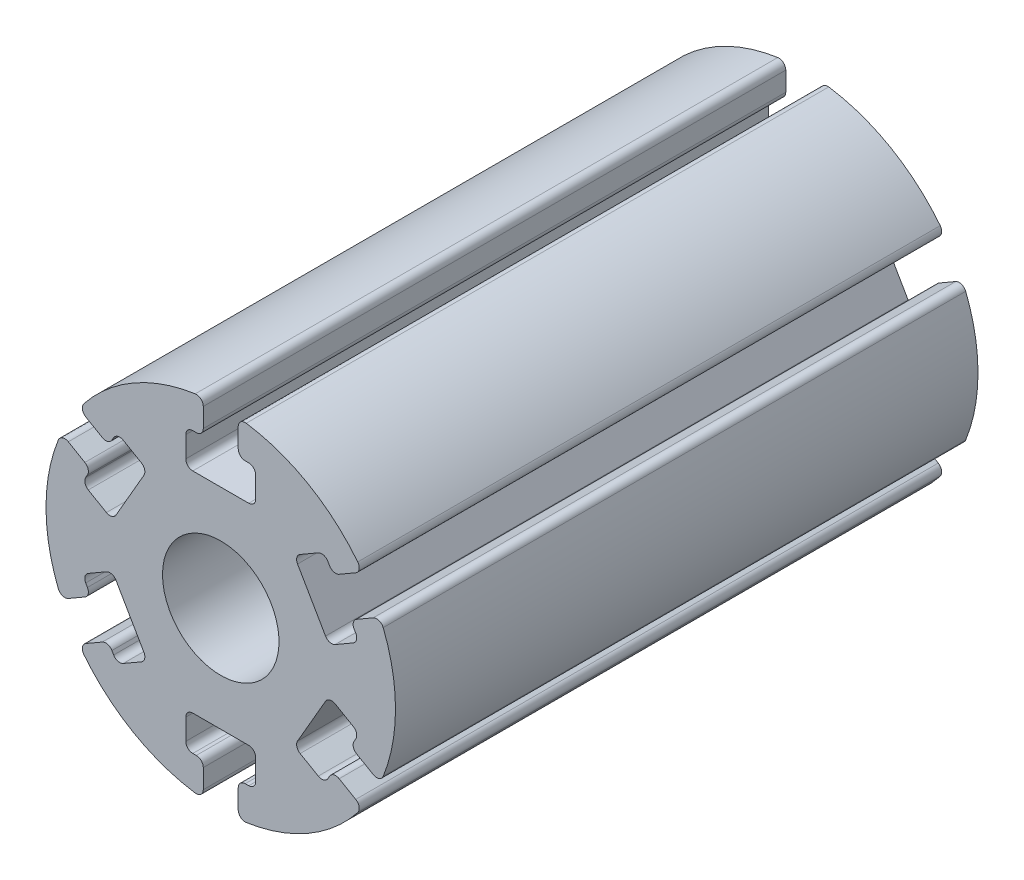
from build123d import *

# Parameters (mm, degrees)
ESBO_O1_R                = 7.5
RESSALTO_EXTRUS_O1_DEPTH = 12.5
ESBO_O7_R                = 2.5
CORTE_EXTRUS_O1_DEPTH    = 16
CORTE_EXTRUS_O2_DEPTH    = 28.156951228
FILETE2_R                = 0.3


with BuildPart() as part:
    # Esboço1 → Ressalto-extrusão1 (new, symmetric)
    with BuildSketch(Plane.XY):
        Circle(ESBO_O1_R)
    extrude(amount=RESSALTO_EXTRUS_O1_DEPTH, both=True)

    # Esboço7 → Corte-extrusão1 (cut)
    with BuildSketch(Plane(origin=(0, 0, 12.5), x_dir=(-1, 0, 0), z_dir=(0, 0, -1))):
        Circle(ESBO_O7_R)
    extrude(amount=CORTE_EXTRUS_O1_DEPTH, mode=Mode.SUBTRACT)

    # Esboço9 → Corte-extrusão2 (cut, through all)
    with BuildSketch(Plane.XY.offset(12.5)):
        Polygon((-0.75, 6), (-0.75, 7.5), (0.75, 7.5), (0.75, 6), (1.5, 6), (1.5, 4.5), (-1.5, 4.5), (-1.5, 6), align=None)
        Polygon((4.446152423, 4.299038106), (3.147114317, 3.549038106), (4.647114317, 0.950961894), (5.946152423, 1.700961894), (5.571152423, 2.350480947), (6.870190528, 3.100480947), (6.120190528, 4.399519053), (4.821152423, 3.649519053), align=None)
        Polygon((5.946152423, -1.700961894), (4.647114317, -0.950961894), (3.147114317, -3.549038106), (4.446152423, -4.299038106), (4.821152423, -3.649519053), (6.120190528, -4.399519053), (6.870190528, -3.100480947), (5.571152423, -2.350480947), align=None)
        Polygon((1.5, -6), (1.5, -4.5), (-1.5, -4.5), (-1.5, -6), (-0.75, -6), (-0.75, -7.5), (0.75, -7.5), (0.75, -6), align=None)
        Polygon((-4.446152423, -4.299038106), (-3.147114317, -3.549038106), (-4.647114317, -0.950961894), (-5.946152423, -1.700961894), (-5.571152423, -2.350480947), (-6.870190528, -3.100480947), (-6.120190528, -4.399519053), (-4.821152423, -3.649519053), align=None)
        Polygon((-5.946152423, 1.700961894), (-4.647114317, 0.950961894), (-3.147114317, 3.549038106), (-4.446152423, 4.299038106), (-4.821152423, 3.649519053), (-6.120190528, 4.399519053), (-6.870190528, 3.100480947), (-5.571152423, 2.350480947), align=None)
    extrude(amount=-CORTE_EXTRUS_O2_DEPTH, mode=Mode.SUBTRACT)

    # Filete2
    filete2_edges = [part.edges().sort_by_distance(p)[0] for p in [
        (0.75, 7.462405778, 0),
        (6.087632977, 4.380721942, 0),
        (4.821152423, 3.649519053, 0),
        (4.446152423, 4.299038106, 0),
        (3.147114317, 3.549038106, 0),
        (4.647114317, 0.950961894, 0),
        (5.946152423, 1.700961894, 0),
        (5.571152423, 2.350480947, 0),
        (6.837632977, 3.081683836, 0),
        (6.837632977, -3.081683836, 0),
        (5.571152423, -2.350480947, 0),
        (5.946152423, -1.700961894, 0),
        (4.647114317, -0.950961894, 0),
        (3.147114317, -3.549038106, 0),
        (4.446152423, -4.299038106, 0),
        (4.821152423, -3.649519053, 0),
        (6.087632977, -4.380721942, 0),
        (0.75, -7.462405778, 0),
        (0.75, -6, 0),
        (1.5, -6, 0),
        (1.5, -4.5, 0),
        (-1.5, -4.5, 0),
        (-1.5, -6, 0),
        (-0.75, -6, 0),
        (-0.75, -7.462405778, 0),
        (-6.087632977, -4.380721942, 0),
        (-4.821152423, -3.649519053, 0),
        (-4.446152423, -4.299038106, 0),
        (-3.147114317, -3.549038106, 0),
        (-4.647114317, -0.950961894, 0),
        (-5.946152423, -1.700961894, 0),
        (-5.571152423, -2.350480947, 0),
        (-6.837632977, -3.081683836, 0),
        (-6.837632977, 3.081683836, 0),
        (-5.571152423, 2.350480947, 0),
        (-5.946152423, 1.700961894, 0),
        (-4.647114317, 0.950961894, 0),
        (-3.147114317, 3.549038106, 0),
        (-4.446152423, 4.299038106, 0),
        (-4.821152423, 3.649519053, 0),
        (-6.087632977, 4.380721942, 0),
        (-0.75, 7.462405778, 0),
        (-0.75, 6, 0),
        (-1.5, 6, 0),
        (1.5, 6, 0),
        (0.75, 6, 0),
        (1.5, 4.5, 0),
        (-1.5, 4.5, 0),
    ]]
    fillet(filete2_edges, radius=FILETE2_R)


solid = part.part
